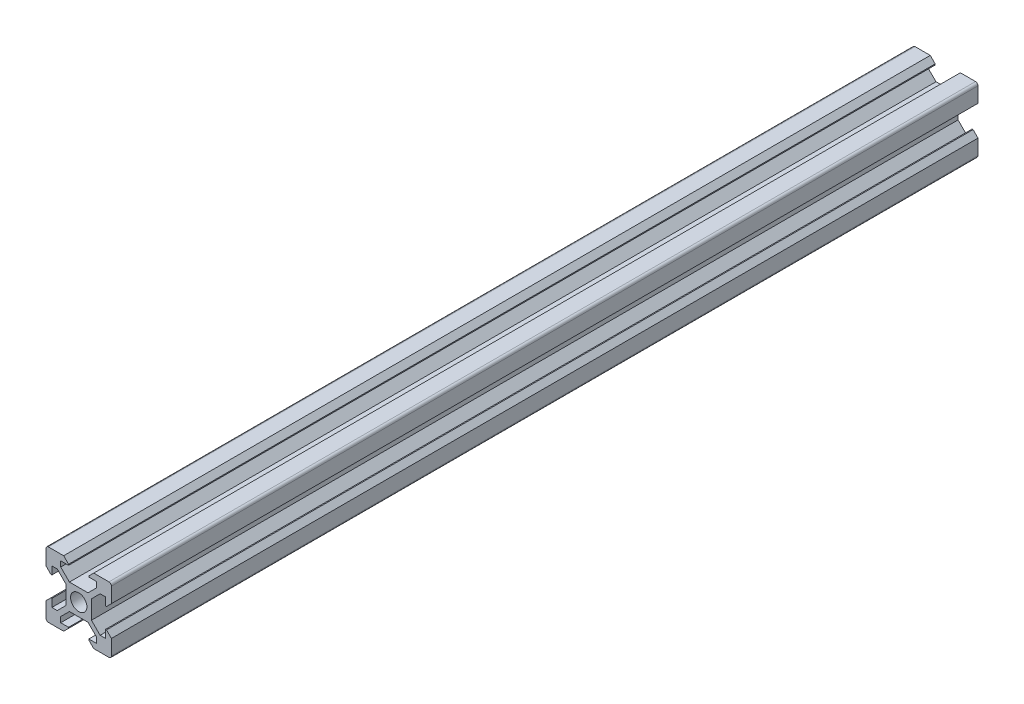
from build123d import *

# Parameters (mm, degrees)
CROQUIS1_R              = 2.5
SALIENTE_EXTRUIR1_DEPTH = 265


with BuildPart() as part:
    # Croquis1 → Saliente-Extruir1 (new body)
    with BuildSketch(Plane.XY):
        with BuildLine():
            Line((-4.6, 10), (-3.1, 8.5))
            Line((-3.1, 8.5), (-3.1, 8.2))
            Line((-3.1, 8.2), (-5.5, 8.2))
            Line((-5.5, 8.2), (-5.5, 6.560660172))
            Line((-5.5, 6.560660172), (-2.84, 3.900660172))
            Line((-2.84, 3.900660172), (0, 3.900660172))
            Line((0, 3.900660172), (2.84, 3.900660172))
            Line((2.84, 3.900660172), (5.5, 6.560660172))
            Line((5.5, 6.560660172), (5.5, 8.2))
            Line((5.5, 8.2), (3.1, 8.2))
            Line((3.1, 8.2), (3.1, 8.5))
            Line((3.1, 8.5), (4.6, 10))
            Line((4.6, 10), (9.25, 10))
            ThreePointArc((9.25, 10), (9.780330086, 9.780330086), (10, 9.25))
            Line((10, 9.25), (10, 4.6))
            Line((10, 4.6), (8.5, 3.1))
            Line((8.5, 3.1), (8.2, 3.1))
            Line((8.2, 3.1), (8.2, 5.5))
            Line((8.2, 5.5), (6.560660172, 5.5))
            Line((6.560660172, 5.5), (3.900660172, 2.84))
            Line((3.900660172, 2.84), (3.900660172, 0))
            Line((3.900660172, 0), (3.900660172, -2.84))
            Line((3.900660172, -2.84), (6.560660172, -5.5))
            Line((6.560660172, -5.5), (8.2, -5.5))
            Line((8.2, -5.5), (8.2, -3.1))
            Line((8.2, -3.1), (8.5, -3.1))
            Line((8.5, -3.1), (10, -4.6))
            Line((10, -4.6), (10, -9.25))
            ThreePointArc((10, -9.25), (9.780330086, -9.780330086), (9.25, -10))
            Line((9.25, -10), (4.6, -10))
            Line((4.6, -10), (3.1, -8.5))
            Line((3.1, -8.5), (3.1, -8.2))
            Line((3.1, -8.2), (5.5, -8.2))
            Line((5.5, -8.2), (5.5, -6.560660172))
            Line((5.5, -6.560660172), (2.84, -3.900660172))
            Line((2.84, -3.900660172), (0, -3.900660172))
            Line((0, -3.900660172), (-2.84, -3.900660172))
            Line((-2.84, -3.900660172), (-5.5, -6.560660172))
            Line((-5.5, -6.560660172), (-5.5, -8.2))
            Line((-5.5, -8.2), (-3.1, -8.2))
            Line((-3.1, -8.2), (-3.1, -8.5))
            Line((-3.1, -8.5), (-4.6, -10))
            Line((-4.6, -10), (-9.25, -10))
            ThreePointArc((-9.25, -10), (-9.780330086, -9.780330086), (-10, -9.25))
            Line((-10, -9.25), (-10, -4.6))
            Line((-10, -4.6), (-8.5, -3.1))
            Line((-8.5, -3.1), (-8.2, -3.1))
            Line((-8.2, -3.1), (-8.2, -5.5))
            Line((-8.2, -5.5), (-6.560660172, -5.5))
            Line((-6.560660172, -5.5), (-3.900660172, -2.84))
            Line((-3.900660172, -2.84), (-3.900660172, 0))
            Line((-3.900660172, 0), (-3.900660172, 2.84))
            Line((-3.900660172, 2.84), (-6.560660172, 5.5))
            Line((-6.560660172, 5.5), (-8.2, 5.5))
            Line((-8.2, 5.5), (-8.2, 3.1))
            Line((-8.2, 3.1), (-8.5, 3.1))
            Line((-8.5, 3.1), (-10, 4.6))
            Line((-10, 4.6), (-10, 9.25))
            ThreePointArc((-10, 9.25), (-9.780330086, 9.780330086), (-9.25, 10))
            Line((-9.25, 10), (-4.6, 10))
        make_face()
        Circle(CROQUIS1_R, mode=Mode.SUBTRACT)
    extrude(amount=SALIENTE_EXTRUIR1_DEPTH)


solid = part.part
